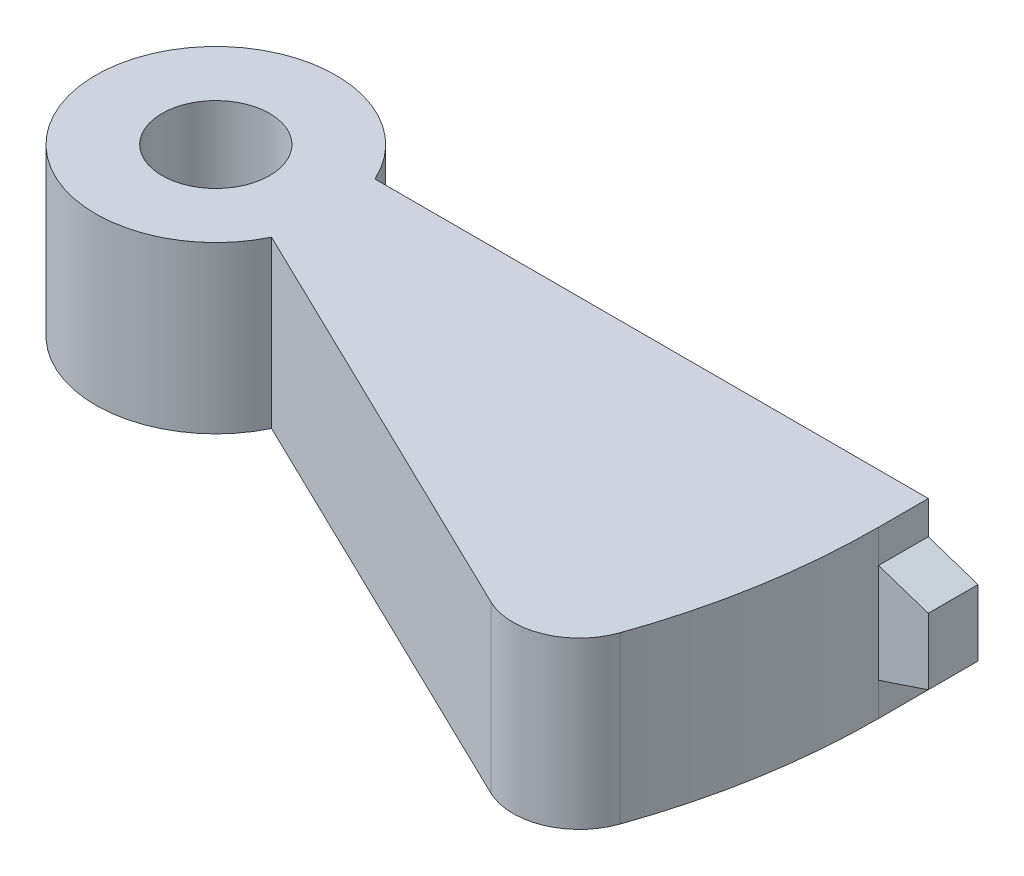
from build123d import *

# Parameters (mm, degrees)
BOSS_EXTRUDE1_DEPTH             = 2.5
BOSS_EXTRUDE2_DEPTH             = 1.5
BOSS_EXTRUDE3_REACH             = 25.076
SKETCH2_R                       = 3.625
SKETCH2_R_2                     = 1.625
BOSS_EXTRUDE3_DIRECTION_2_REACH = 25.076
CUT_EXTRUDE1_DEPTH              = 24.075961518
CUT_EXTRUDE1_DEPTH_BACK         = 24.075961518
SKETCH2_2_R                     = 1.625


with BuildPart() as part:
    # Sketch1 → Boss-Extrude1 (new, symmetric)
    with BuildSketch(Plane(origin=(0, 0, 0), x_dir=(1, 0, 0), z_dir=(0, 1, 0))):
        with BuildLine():
            Line((0, 0), (20, 0))
            ThreePointArc((20, 0), (19.711971193, -3.382039575), (18.856180832, -6.666666667))
            ThreePointArc((18.856180832, -6.666666667), (17.730737476, -7.849901182), (16.098510968, -7.799868243))
            Line((16.098510968, -7.799868243), (0, 0))
        make_face()
    extrude(amount=BOSS_EXTRUDE1_DEPTH, both=True)

    # Sketch3 → Boss-Extrude2 (add)
    with BuildSketch(Plane(origin=(0, 0, 0), x_dir=(-1, 0, 0), z_dir=(0, 0, -1))):
        Polygon((-20, -2.5), (-20, -1.5), (-21.5, -1), (-21.5, 1), (-20, 1.5), (-20, 2.5), (0, 2.5), (0, -2.5), align=None)
    extrude(amount=BOSS_EXTRUDE2_DEPTH)

    # Boss-Extrude3: up to this face of the body (flat: up to its plane)
    boss_extrude3_end = Plane(part.part.faces().sort_by_distance((12.117739378, 2.5, 1.980857932))[0])
    # Sketch2 → Boss-Extrude3 (add, up to the picked face)
    with BuildSketch(Plane(origin=(0, 0, 0), x_dir=(1, 0, 0), z_dir=(0, 1, 0)), mode=Mode.PRIVATE) as boss_extrude3_sk1:
        Circle(SKETCH2_R)
        Circle(SKETCH2_R_2, mode=Mode.SUBTRACT)
    boss_extrude3_tool1 = split(extrude(boss_extrude3_sk1.sketch, amount=BOSS_EXTRUDE3_REACH, mode=Mode.PRIVATE), bisect_by=boss_extrude3_end, keep=Keep.BOTH, mode=Mode.PRIVATE)
    add(boss_extrude3_tool1.solids().sort_by(Axis((-3.52247, 0, 0), (0, 1, 0)))[0])

    # Boss-Extrude3 direction 2: up to this face of the body (flat: up to its plane)
    boss_extrude3_direction_2_end = Plane(part.part.faces().sort_by_distance((12.117739378, -2.5, 1.980857932))[0])
    # Sketch2 → Boss-Extrude3 direction 2 (add, up to the picked face)
    with BuildSketch(Plane(origin=(0, 0, 0), x_dir=(1, 0, 0), z_dir=(0, 1, 0)), mode=Mode.PRIVATE) as boss_extrude3_direction_2_sk1:
        Circle(SKETCH2_R)
        Circle(SKETCH2_R_2, mode=Mode.SUBTRACT)
    boss_extrude3_direction_2_tool1 = split(extrude(boss_extrude3_direction_2_sk1.sketch, amount=-BOSS_EXTRUDE3_DIRECTION_2_REACH, mode=Mode.PRIVATE), bisect_by=boss_extrude3_direction_2_end, keep=Keep.BOTH, mode=Mode.PRIVATE)
    add(boss_extrude3_direction_2_tool1.solids().sort_by(Axis((-3.52247, 0, 0), (0, -1, 0)))[0])

    # Sketch2<2> → Cut-Extrude1 (cut, two sides: drawn at the far end of the back side and taken through both)
    with BuildSketch(Plane(origin=(0, 0, 0), x_dir=(1, 0, 0), z_dir=(0, 1, 0)).offset(-CUT_EXTRUDE1_DEPTH_BACK)):
        Circle(SKETCH2_2_R)
    extrude(amount=CUT_EXTRUDE1_DEPTH + CUT_EXTRUDE1_DEPTH_BACK, mode=Mode.SUBTRACT)


solid = part.part
